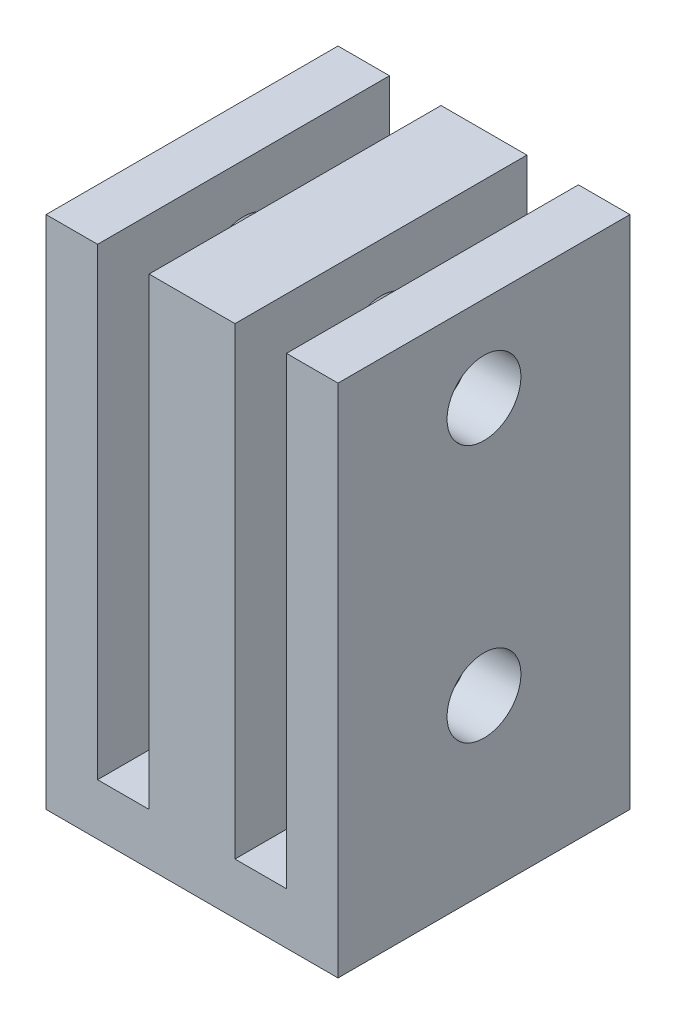
from build123d import *

# Parameters (mm, degrees)
SKETCH1_W           = 17
SKETCH1_H           = 17
BOSS_EXTRUDE1_DEPTH = 30
SKETCH2_W           = 3
SKETCH2_H           = 27
CUT_EXTRUDE1_DEPTH  = 39.444765573
SKETCH3_R           = 2.15
CUT_EXTRUDE2_DEPTH  = 39.444765573


with BuildPart() as part:
    # Sketch1 → Boss-Extrude1 (new body)
    with BuildSketch(Plane(origin=(0, 0, 0), x_dir=(1, 0, 0), z_dir=(0, 1, 0))):
        with Locations((8.5, 8.5)):
            Rectangle(SKETCH1_W, SKETCH1_H)
    extrude(amount=BOSS_EXTRUDE1_DEPTH)

    # Sketch2 → Cut-Extrude1 (cut, through all)
    with BuildSketch(Plane.XY):
        with Locations((4.5, 16.5)):
            Rectangle(SKETCH2_W, SKETCH2_H)
        with Locations((12.5, 16.5)):
            Rectangle(SKETCH2_W, SKETCH2_H)
    extrude(amount=-CUT_EXTRUDE1_DEPTH, mode=Mode.SUBTRACT)

    # Sketch3 → Cut-Extrude2 (cut, through all)
    with BuildSketch(Plane.ZY):
        with Locations((-8.5, 25)):
            Circle(SKETCH3_R)
        with Locations((-8.5, 10)):
            Circle(SKETCH3_R)
    extrude(amount=-CUT_EXTRUDE2_DEPTH, mode=Mode.SUBTRACT)


solid = part.part
